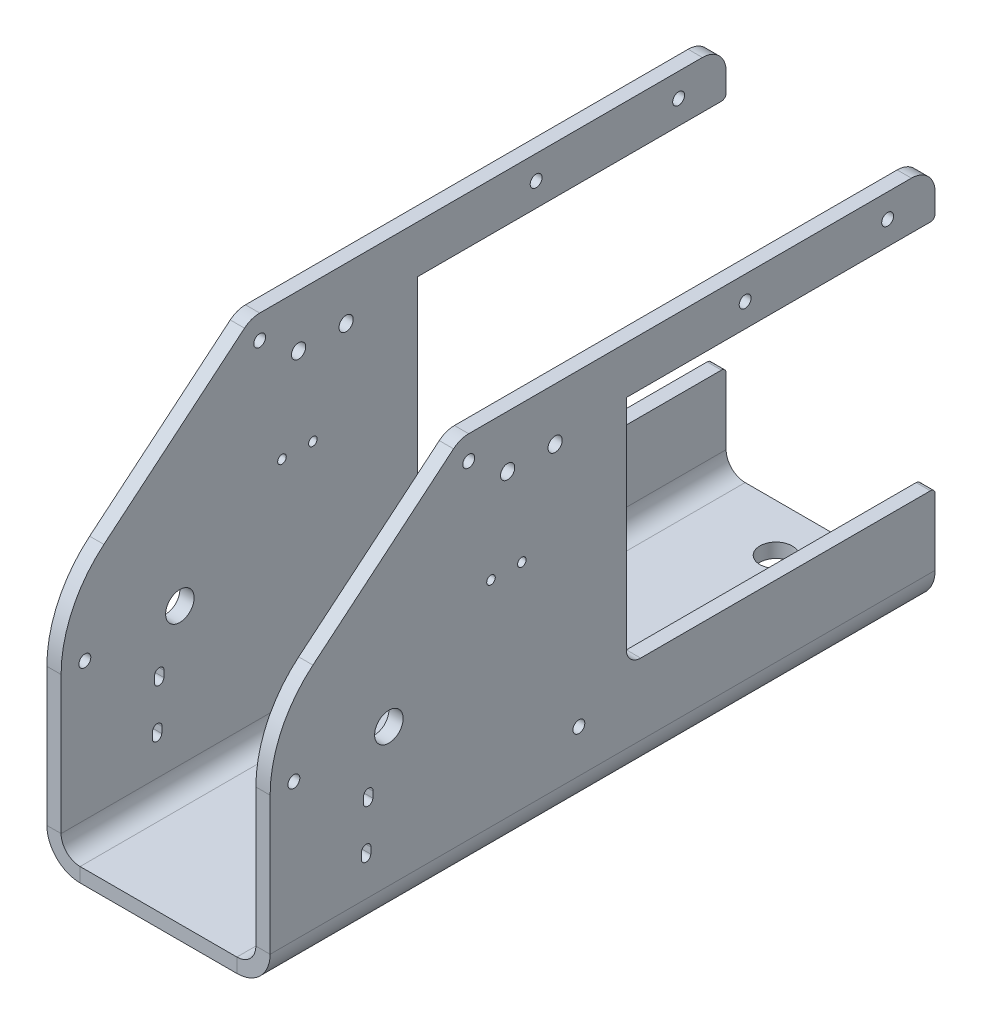
from build123d import *

# Parameters (mm, degrees)
SKETCH1_R              = 3
SKETCH1_R_2            = 1.25
SKETCH1_R_3            = 1.5
SKETCH1_R_4            = 0.9
BOSS_EXTRUDE1_DEPTH    = 3
FILLET1_R              = 5
FILLET2_R              = 1
CUT_EXTRUDE1_DEPTH     = 100.949987494
SKETCH4_W              = 140
SKETCH4_H              = 3
BOSS_EXTRUDE2_DEPTH    = 20.5
FILLET4_R              = 3
CONVERT_SOLID1_START   = -65
CONVERT_SOLID1_DEPTH   = 140
CONVERT_SOLID1_2_DEPTH = 140
SKETCH9_R              = 3.4
CUT_EXTRUDE3_DEPTH     = 119.836021475


# Read off the part's stored shape, not the designer's step: Convert-Solid1
with BuildPart() as part:
    # Sketch1 → Boss-Extrude1 (new body)
    with BuildSketch(Plane(origin=(0, 0, 0), x_dir=(0, 0, -1), z_dir=(1, 0, 0))):
        with BuildLine():
            Line((0, 5), (65, 5))
            Line((65, 5), (65, 15))
            Line((65, 15), (-35, 15))
            Line((-35, 15), (-65.988977704, -10.781451876))
            ThreePointArc((-65.988977704, -10.781451876), (-72.635419618, -19.386905319), (-75, -30))
            Line((-75, -30), (-75, -66))
            Line((-75, -66), (65, -66))
            Line((65, -66), (65, -44))
            Line((65, -44), (0, -44))
            Line((0, -44), (0, 5))
        make_face()
        with Locations((-50, -30)):
            Circle(SKETCH1_R, mode=Mode.SUBTRACT)
        with Locations((55, 10)):
            Circle(SKETCH1_R_2, mode=Mode.SUBTRACT)
        with Locations((25, 10)):
            Circle(SKETCH1_R_2, mode=Mode.SUBTRACT)
        with Locations((-33.192050804, 10)):
            Circle(SKETCH1_R_2, mode=Mode.SUBTRACT)
        with Locations((-70, -30)):
            Circle(SKETCH1_R_2, mode=Mode.SUBTRACT)
        with Locations((-10, -50)):
            Circle(SKETCH1_R_2, mode=Mode.SUBTRACT)
        with Locations((-25, 4)):
            Circle(SKETCH1_R_3, mode=Mode.SUBTRACT)
        with Locations((-15, 4)):
            Circle(SKETCH1_R_3, mode=Mode.SUBTRACT)
        with Locations((-22, -14)):
            Circle(SKETCH1_R_4, mode=Mode.SUBTRACT)
        with Locations((-28.5, -14)):
            Circle(SKETCH1_R_4, mode=Mode.SUBTRACT)
    extrude(amount=BOSS_EXTRUDE1_DEPTH)

    # Fillet1
    fillet1_edges = [part.edges().sort_by_distance(p)[0] for p in [
        (1.5, 15, 35),
        (1.5, 15, -65),
    ]]
    fillet(fillet1_edges, radius=FILLET1_R)

    # Fillet2
    fillet2_edges = [part.edges().sort_by_distance(p)[0] for p in [
        (1.5, 5, -65),
        (1.5, -44, -65),
    ]]
    fillet(fillet2_edges, radius=FILLET2_R)

    # Sketch2 → Cut-Extrude1 (cut, through all)
    with BuildSketch(Plane(origin=(3, 0, 0), x_dir=(0, 0, -1), z_dir=(1, 0, 0))):
        with BuildLine():
            Line((-53.319244679, -40.106902918), (-53.373768913, -41.355713195))
            ThreePointArc((-53.373768913, -41.355713195), (-54.416436522, -42.31114203), (-55.371865356, -41.268474421))
            Line((-55.371865356, -41.268474421), (-55.317341122, -40.019664144))
            ThreePointArc((-55.317341122, -40.019664144), (-54.274673513, -39.06423531), (-53.319244679, -40.106902918))
        make_face()
        with BuildLine():
            Line((-55.80805923, -51.258956637), (-55.753534996, -50.01014636))
            ThreePointArc((-55.753534996, -50.01014636), (-54.710867387, -49.054717525), (-53.755438553, -50.097385134))
            Line((-53.755438553, -50.097385134), (-53.809962787, -51.346195411))
            ThreePointArc((-53.809962787, -51.346195411), (-54.852630396, -52.301624245), (-55.80805923, -51.258956637))
        make_face()
    extrude(amount=-CUT_EXTRUDE1_DEPTH, mode=Mode.SUBTRACT)

    # Sketch4 → Boss-Extrude2 (add)
    with BuildSketch(Plane.ZY):
        with Locations((5, -64.5)):
            Rectangle(SKETCH4_W, SKETCH4_H)
    extrude(amount=BOSS_EXTRUDE2_DEPTH)

    # Fillet4
    fillet4_edges = [part.edges().sort_by_distance(p)[0] for p in [
        (1.5, -44, 0),
    ]]
    fillet(fillet4_edges, radius=FILLET4_R)

    # Mirror1: part across plane


with BuildPart() as part_1:
    add(part.part)
    add(part.part.mirror(Plane(origin=(-20.5, 0, 0), x_dir=(0, 0, 1), z_dir=(1, 0, 0))))

    # Convert-Solid1 outline → Convert-Solid1 (cut)
    with BuildSketch(Plane.XY.offset(CONVERT_SOLID1_START)):
        with BuildLine():
            ThreePointArc((3, -59), (0.949747468, -63.949747468), (-4, -66))
            Line((-4, -66), (3, -66))
            Line((3, -66), (3, -59))
        make_face()
        with BuildLine():
            Line((-44, -66), (-37, -66))
            ThreePointArc((-37, -66), (-41.949747468, -63.949747468), (-44, -59))
            Line((-44, -59), (-44, -66))
        make_face()
    extrude(amount=CONVERT_SOLID1_DEPTH, mode=Mode.SUBTRACT)

    # Convert-Solid1 2 outline → Convert-Solid1 2 (add)
    with BuildSketch(Plane.XY.offset(CONVERT_SOLID1_START)):
        with BuildLine():
            Line((-41, -63), (-37, -63))
            ThreePointArc((-37, -63), (-39.828427125, -61.828427125), (-41, -59))
            Line((-41, -59), (-41, -63))
        make_face()
        with BuildLine():
            ThreePointArc((0, -59), (-1.171572875, -61.828427125), (-4, -63))
            Line((-4, -63), (0, -63))
            Line((0, -63), (0, -59))
        make_face()
    extrude(amount=CONVERT_SOLID1_2_DEPTH)

    # Sketch9 → Cut-Extrude3 (cut, through all)
    with BuildSketch(Plane.XZ.offset(66)):
        with Locations(Location((-20.5, -55, 0), (0, 0, 270))):
            Circle(SKETCH9_R)
    extrude(amount=-CUT_EXTRUDE3_DEPTH, mode=Mode.SUBTRACT)


solid = part_1.part
